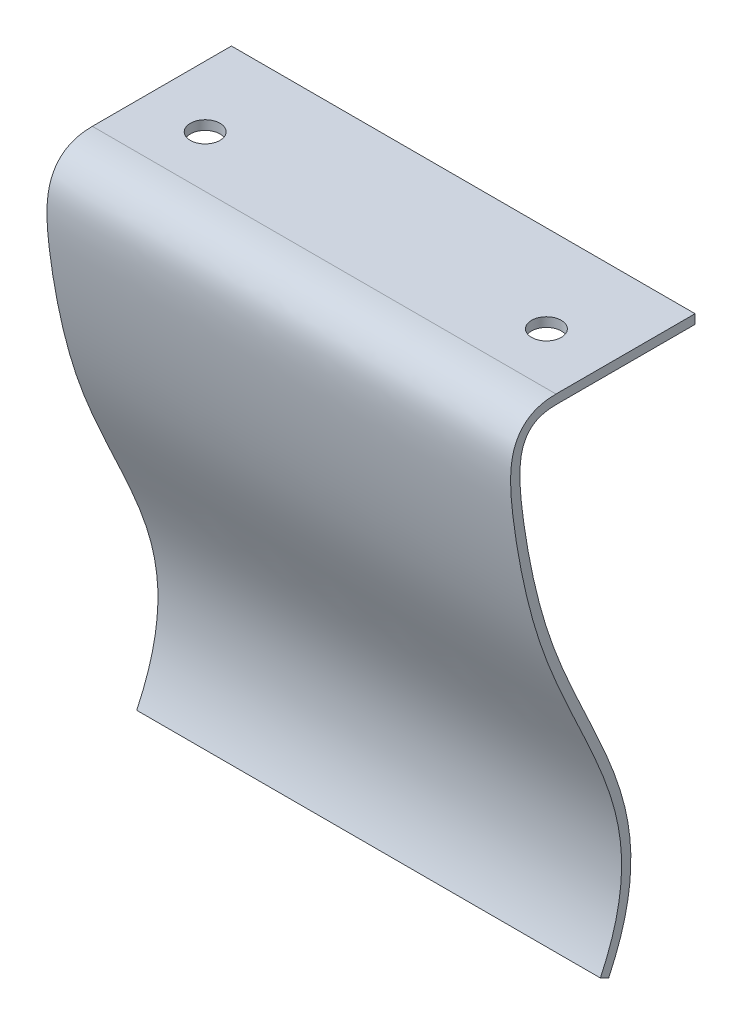
from build123d import *

# Parameters (mm, degrees)
EXTRUDE_THIN1_DEPTH = 50
CUT_EXTRUDE1_REACH  = 85.277
SKETCH2_R           = 1.6


# Read off the part's stored shape, not the designer's step: Extrude-Thin1
with BuildPart() as part:
    # Extrude-Thin1 outline → Extrude-Thin1 (new body)
    with BuildSketch(Plane(origin=(0, 0, 0), x_dir=(0, 0, -1), z_dir=(1, 0, 0))):
        with BuildLine():
            Line((-13.931542172, 55.622526893), (-28.931542172, 55.622526893))
            add(Edge.make_bspline(
                [(-28.931542172, 55.622526893), (-29.549530134, 55.622526893), (-30.114138104, 55.556690209), (-31.147400567, 55.273940754), (-31.616263653, 55.054290587), (-32.420117271, 54.462523347), (-32.750872262, 54.092295289), (-33.258461948, 53.268137207), (-33.437751095, 52.81632881), (-33.688973701, 51.864721877), (-33.761795788, 51.363551833), (-33.83586905, 50.312734233), (-33.836847299, 49.762672962), (-33.788931496, 48.613624013), (-33.739872128, 48.014630646), (-33.609018087, 46.771199339), (-33.528189966, 46.127707108), (-33.066411807, 42.7917721), (-32.496433656, 39.763109852), (-31.317171415, 35.293819828), (-30.867344304, 33.816521932), (-29.865874163, 30.988620892), (-29.31903602, 29.630483463), (-27.620323902, 25.686694323), (-26.411000303, 23.231197625), (-24.251421121, 18.473393522), (-23.302119784, 16.172068114), (-22.041511098, 11.534502139), (-21.726945023, 9.201516962), (-22.084322569, 4.242440477), (-22.755874989, 1.608547001), (-24.143339818, -1.31322204)],
                knots=[0, 0, 0, 0, 0.03125, 0.03125, 0.0625, 0.0625, 0.09375, 0.09375, 0.125, 0.125, 0.15625, 0.15625, 0.1875, 0.1875, 0.21875, 0.21875, 0.25, 0.25, 0.375, 0.375, 0.4375, 0.4375, 0.5, 0.5, 0.625, 0.625, 0.75, 0.75, 0.875, 0.875, 1, 1, 1, 1], degree=3))
            Line((-24.143339818, -1.31322204), (-23.24001733, -1.742184139))
            add(Edge.make_bspline(
                [(-28.931542172, 54.622526893), (-33.062480615, 54.622526893), (-33.243762581, 48.644679169), (-28.338002839, 23.443395106), (-16.595316035, 12.250446249), (-23.24001733, -1.742184139)],
                knots=[0, 0, 0, 0, 0.236283029, 0.420799842, 1, 1, 1, 1], degree=3))
            Line((-28.931542172, 54.622526893), (-13.931542172, 54.622526893))
            Line((-13.931542172, 54.622526893), (-13.931542172, 55.622526893))
        make_face()
    extrude(amount=EXTRUDE_THIN1_DEPTH)

    # Sketch2 → Cut-Extrude1 (cut, up to next)
    with BuildSketch(Plane(origin=(0, 55.622526893, 0), x_dir=(1, 0, 0), z_dir=(0, 1, 0)), mode=Mode.PRIVATE) as cut_extrude1_sk1:
        with Locations(Location((43.4, -23.361542172, 0), (0, 0, 270))):
            Circle(SKETCH2_R)
    cut_extrude1_tool1 = extrude(cut_extrude1_sk1.sketch, amount=-CUT_EXTRUDE1_REACH, mode=Mode.PRIVATE) & part.part
    # Sketch2 → Cut-Extrude1 (cut, up to next)
    with BuildSketch(Plane(origin=(0, 55.622526893, 0), x_dir=(1, 0, 0), z_dir=(0, 1, 0)), mode=Mode.PRIVATE) as cut_extrude1_sk2:
        with Locations(Location((6.6, -23.361542172, 0), (0, 0, 270))):
            Circle(SKETCH2_R)
    cut_extrude1_tool2 = extrude(cut_extrude1_sk2.sketch, amount=-CUT_EXTRUDE1_REACH, mode=Mode.PRIVATE) & part.part
    add(cut_extrude1_tool1.solids().sort_by_distance((43.4, 55.622527, 23.361542))[0], mode=Mode.SUBTRACT)
    add(cut_extrude1_tool2.solids().sort_by_distance((6.6, 55.622527, 23.361542))[0], mode=Mode.SUBTRACT)


solid = part.part
